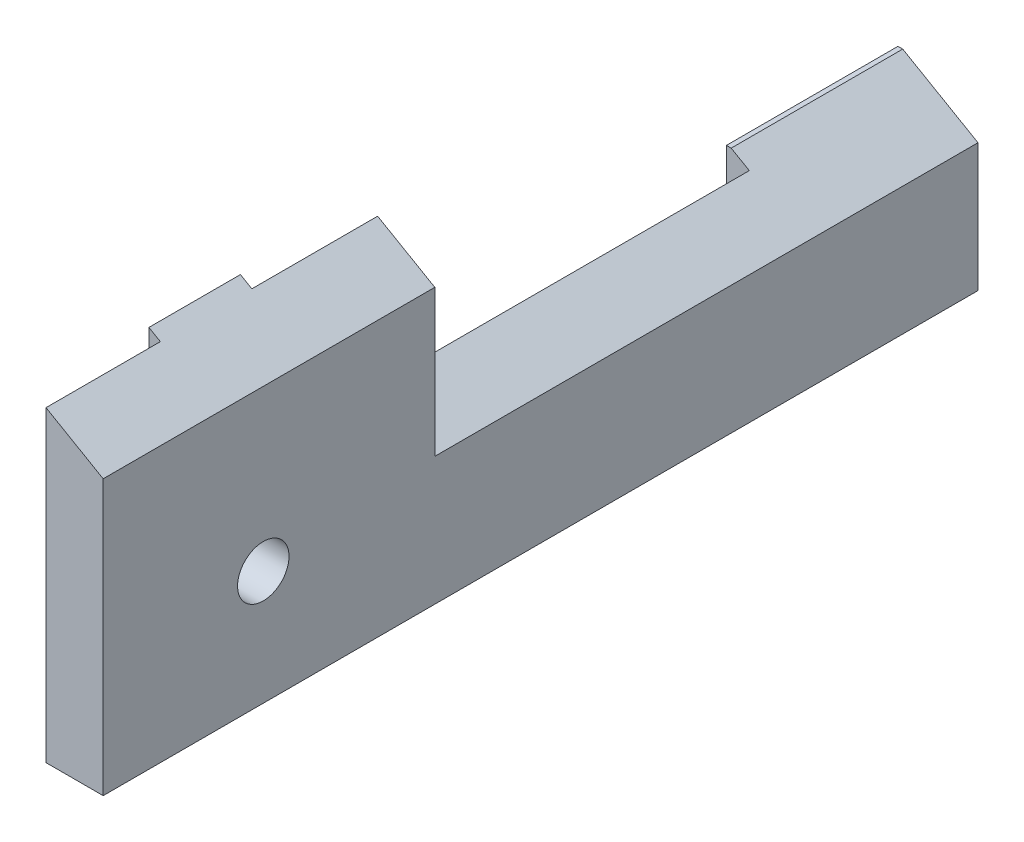
from build123d import *

# Parameters (mm, degrees)
BOSS_EXTRUDE1_DEPTH = 14
SKETCH2_R           = 2.25
CUT_EXTRUDE1_DEPTH  = 42.328712779
SKETCH4_W           = 47.5
SKETCH4_H           = 13
CUT_EXTRUDE3_DEPTH  = 42.328712779
CHAMFER1_SIZE       = 6.92820323
CHAMFER1_SIZE_2     = 4
CHAMFER2_SIZE       = 3.8
CHAMFER2_SIZE2      = 6.581793069


with BuildPart() as part:
    # Sketch1 → Boss-Extrude1 (new, symmetric)
    with BuildSketch(Plane(origin=(0, 0, 0), x_dir=(1, 0, 0), z_dir=(0, 1, 0))):
        Polygon((-5, -20.25), (-5, 23.25), (-7, 23.25), (-7, 38.25), (0, 38.25), (0, -38.25), (-5, -38.25), (-5, -28.25), (-6, -28.25), (-6, -20.25), align=None)
    extrude(amount=BOSS_EXTRUDE1_DEPTH, both=True)

    # Sketch2 → Cut-Extrude1 (cut, through all)
    with BuildSketch(Plane(origin=(0, 0, 0), x_dir=(0, 0, -1), z_dir=(1, 0, 0))):
        with Locations((-24.25, -4)):
            Circle(SKETCH2_R)
    extrude(amount=-CUT_EXTRUDE1_DEPTH, mode=Mode.SUBTRACT)

    # Sketch4 → Cut-Extrude3 (cut, through all)
    with BuildSketch(Plane(origin=(0, 0, 0), x_dir=(0, 0, -1), z_dir=(1, 0, 0))):
        with Locations((14.5, 7.5)):
            Rectangle(SKETCH4_W, SKETCH4_H)
    extrude(amount=-CUT_EXTRUDE3_DEPTH, mode=Mode.SUBTRACT)

    # Chamfer1
    # the kernel refuses this chamfer: 6.92820323, 4 mm, written as the material it takes off along each edge
    with BuildSketch(Plane(origin=(0, 14, -8.673855882), x_dir=(-0.9998132206222079, 0.01932676561270069, 0), z_dir=(0, 0, 1))) as chamfer1_piece_1:
        Polygon((CHAMFER1_SIZE * 0.999813220662, CHAMFER1_SIZE * 0.0193267656135), (-CHAMFER1_SIZE_2 * 0.0193267656127, CHAMFER1_SIZE_2 * 0.999813220622), (0, 0), align=None)
    extrude(amount=64.847711765, mode=Mode.SUBTRACT)

    # Chamfer2
    chamfer2_edges = [part.edges().sort_by_distance(p)[0] for p in [
        (0, 1, -14.5),
    ]]
    chamfer2_side = [part.faces().sort_by_distance(p)[0] for p in [
        (0, -4.279514007, 4.174270011),
    ]]
    chamfer(chamfer2_edges, length=CHAMFER2_SIZE, length2=CHAMFER2_SIZE2, reference=chamfer2_side[0])


solid = part.part
